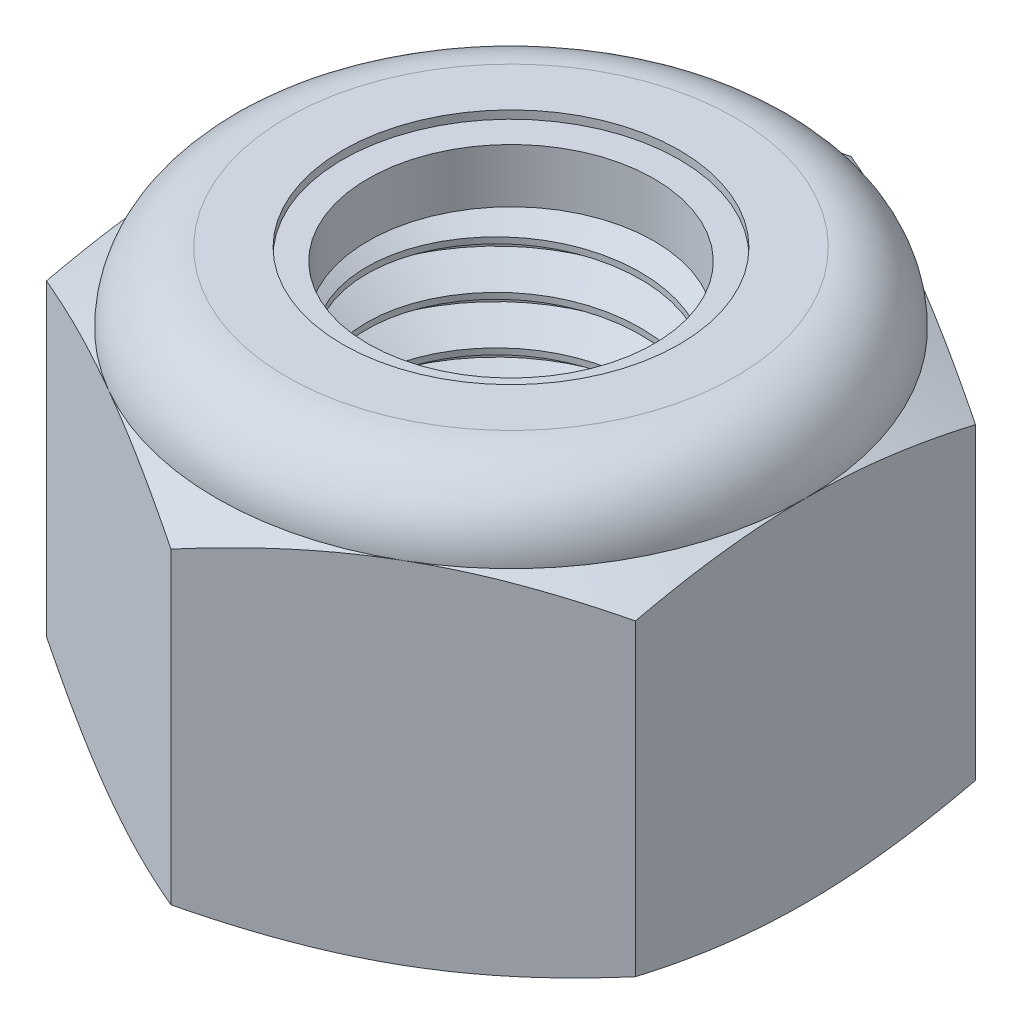
from build123d import *

# Parameters (mm, degrees)
SKETCH1_R        = 3.175
EXTRUDE1_DEPTH   = 7.9375
SKETCH2_W        = 3.175
SKETCH2_H        = 6.614583333
CUT_SWEEP1_PITCH = 0.907142857
SKETCH12_W       = 3.4925
SKETCH12_H       = 6.614583333


with BuildPart() as part:
    # Sketch1 → Extrude1 (new body)
    with BuildSketch(Plane(origin=(0, 0, 0), x_dir=(1, 0, 0), z_dir=(0, 1, 0))):
        Polygon((0, 6.415804866), (-5.55625, 3.207902433), (-5.55625, -3.207902433), (0, -6.415804866), (5.55625, -3.207902433), (5.55625, 3.207902433), align=None)
        with Locations(Location((0, 0, 0), (0, 0, 270))):
            Circle(SKETCH1_R, mode=Mode.SUBTRACT)
    extrude(amount=EXTRUDE1_DEPTH)

    # Sketch5 → Cut-Revolve3 (revolve, cut)
    with BuildSketch(Plane(origin=(0, 0, 0), x_dir=(0, 0, -1), z_dir=(1, 0, 0))):
        with BuildLine():
            Line((0, 0), (5.55625, 0))
            Line((5.55625, 0), (6.415804866, 0.400817017))
            Line((6.415804866, 0.400817017), (6.415804866, 6.213766317))
            Line((6.415804866, 6.213766317), (5.55625, 6.614583333))
            ThreePointArc((5.55625, 6.614583333), (5.168776679, 7.550026679), (4.233333333, 7.9375))
            Line((4.233333333, 7.9375), (4.233333333, 9.2075))
            Line((4.233333333, 9.2075), (7.685804866, 9.2075))
            Line((7.685804866, 9.2075), (7.685804866, -1.27))
            Line((7.685804866, -1.27), (0, -1.27))
            Line((0, -1.27), (0, 0))
        make_face()
    revolve(axis=Axis((0, 0, 0), (0, 1, 0)), mode=Mode.SUBTRACT)

    # Sketch6 → Cut-Revolve4 (revolve, cut)
    with BuildSketch(Plane(origin=(0, 0, 0), x_dir=(0, 0, -1), z_dir=(1, 0, 0)), mode=Mode.PRIVATE) as cut_revolve4_sk:
        with BuildLine():
            Line((0, 6.614583333), (5.40385, 6.614583333))
            ThreePointArc((5.40385, 6.614583333), (5.061013606, 7.442263606), (4.233333333, 7.7851))
            Line((4.233333333, 7.7851), (2.116666667, 7.7851))
            Line((2.116666667, 7.7851), (2.116666667, 9.2075))
            Line((2.116666667, 9.2075), (0, 9.2075))
            Line((0, 9.2075), (0, 6.614583333))
        make_face()
    revolve(cut_revolve4_sk.sketch.rotate(Axis((0, 9.2075, 0), (0, -1, 0)), 180), axis=Axis((0, 9.2075, 0), (0, -1, 0)), mode=Mode.SUBTRACT)

    # Sketch4 → Cut-Revolve2 (revolve, cut)
    with BuildSketch(Plane(origin=(0, 0, 0), x_dir=(0, 0, -1), z_dir=(1, 0, 0))):
        Polygon((0, 6.614583333), (3.4925, 6.614583333), (0, 4.986003837), align=None)
        Polygon((0, 1.628579496), (3.4925, 0), (0, 0), align=None)
    revolve(axis=Axis((0, 0, 0), (0, 1, 0)), mode=Mode.SUBTRACT)

    # Sketch12 → Revolve4 (revolve)
    with BuildSketch(Plane(origin=(0, 0, 0), x_dir=(0, 0, -1), z_dir=(1, 0, 0)), mode=Mode.PRIVATE) as revolve4_sk:
        with Locations((1.74625, 3.307291667)):
            Rectangle(SKETCH12_W, SKETCH12_H)
    revolve(revolve4_sk.sketch.rotate(Axis((0, 0, 0), (0, 1, 0)), 358.692608044), axis=Axis((0, 0, 0), (0, 1, 0)))


with BuildPart() as body_2:
    # Sketch7 → Revolve2 (revolve)
    with BuildSketch(Plane(origin=(0, 0, 0), x_dir=(0, 0, -1), z_dir=(1, 0, 0))):
        with BuildLine():
            Line((2.69875, 6.690783333), (5.324993778, 6.690783333))
            ThreePointArc((5.324993778, 6.690783333), (4.979705237, 7.4148695), (4.233333333, 7.7089))
            Line((4.233333333, 7.7089), (2.69875, 7.7089))
            Line((2.69875, 7.7089), (2.69875, 6.690783333))
        make_face()
    revolve(axis=Axis((0, 6.690783333, 0), (0, 1, 0)))


with BuildPart() as body_3:
    # Sketch2 → Revolve1 (revolve)
    with BuildSketch(Plane(origin=(0, 0, 0), x_dir=(0, 0, -1), z_dir=(1, 0, 0))):
        with Locations((1.5875, 3.307291667)):
            Rectangle(SKETCH2_W, SKETCH2_H)
    revolve(axis=Axis((0, -3.175, 0), (0, 1, 0)))

    # Cut-Sweep1: the profile of Sketch9 screwed along a right-hand helix of 9.75 turns, 8 arcs to a turn; built about Z, then put on its axis
    cut_sweep1_z = Axis((0, 0, 0), (0, 0, 1))
    cut_sweep1_corners = [(3.273201095, 0, 0.056696429), (3.224100547, 0, -0.822098214), (2.585793431, 0, -0.453571429), (2.585793431, 0, -0.340178571)]
    with BuildLine(mode=Mode.PRIVATE) as cut_sweep1_profile:
        Line(cut_sweep1_corners[0], cut_sweep1_corners[1])
        Line(cut_sweep1_corners[1], cut_sweep1_corners[2])
        Line(cut_sweep1_corners[2], cut_sweep1_corners[3])
        Line(cut_sweep1_corners[3], cut_sweep1_corners[0])
    cut_sweep1_cap = Face(cut_sweep1_profile.wire())
    cut_sweep1_turn_angles = [0, 22.5, 45, 67.5, 90, 112.5, 135, 157.5, 180, 202.5, 225, 247.5, 270, 292.5, 315, 337.5, 360]
    cut_sweep1_turn_weights = [1, 0.9238795325112867, 1, 0.9238795325112867, 1, 0.9238795325112867, 1, 0.9238795325112867, 1, 0.9238795325112867, 1, 0.9238795325112867, 1, 0.9238795325112867, 1, 0.9238795325112867, 1]
    cut_sweep1_turn_rails = [Edge.make_bspline([Vector(p[0], p[1], 0).rotate(cut_sweep1_z, cut_sweep1_turn_angles[k]) / cut_sweep1_turn_weights[k] + Vector(0, 0, p[2] + CUT_SWEEP1_PITCH * cut_sweep1_turn_angles[k] / 360) for k in range(17)], [0, 0, 0, 1, 1, 2, 2, 3, 3, 4, 4, 5, 5, 6, 6, 7, 7, 8, 8, 8], 2, cut_sweep1_turn_weights) for p in cut_sweep1_corners]
    cut_sweep1_turn_sides = [Face.make_surface_from_curves(cut_sweep1_turn_rails[p[0]], cut_sweep1_turn_rails[p[1]]) for p in [(0, 1), (1, 2), (2, 3), (3, 0)]]
    cut_sweep1_last_angles = [3240, 3262.5, 3285, 3307.5, 3330, 3352.5, 3375, 3397.5, 3420, 3442.5, 3465, 3487.5, 3510]
    cut_sweep1_last_weights = [1, 0.9238795325112867, 1, 0.9238795325112867, 1, 0.9238795325112867, 1, 0.9238795325112867, 1, 0.9238795325112867, 1, 0.9238795325112715, 1]
    cut_sweep1_last_rails = [Edge.make_bspline([Vector(p[0], p[1], 0).rotate(cut_sweep1_z, cut_sweep1_last_angles[k]) / cut_sweep1_last_weights[k] + Vector(0, 0, p[2] + CUT_SWEEP1_PITCH * cut_sweep1_last_angles[k] / 360) for k in range(13)], [0, 0, 0, 1, 1, 2, 2, 3, 3, 4, 4, 5, 5, 6, 6, 6], 2, cut_sweep1_last_weights) for p in cut_sweep1_corners]
    cut_sweep1_last_sides = [Face.make_surface_from_curves(cut_sweep1_last_rails[p[0]], cut_sweep1_last_rails[p[1]]) for p in [(0, 1), (1, 2), (2, 3), (3, 0)]]
    cut_sweep1 = Plane(origin=(0, 6.614583333, 0), x_dir=(0, 0, -1), z_dir=(0, -1, 0)) * Solid(Shell([*[p.moved(Location((0, 0, CUT_SWEEP1_PITCH * i))) for i in range(9) for p in cut_sweep1_turn_sides], *cut_sweep1_last_sides, cut_sweep1_cap, cut_sweep1_cap.rotate(cut_sweep1_z, 3510).moved(Location((0, 0, CUT_SWEEP1_PITCH * 3510 / 360)))]))
    add(cut_sweep1, mode=Mode.SUBTRACT)

    # Sketch11 → Revolve3 (revolve)
    with BuildSketch(Plane(origin=(0, 0, 0), x_dir=(0, 0, -1), z_dir=(1, 0, 0))):
        Polygon((0, 0), (3.4925, 0), (0, 1.628579496), align=None)
    revolve(axis=Axis((0, 7.9375, 0), (0, -1, 0)))


with BuildPart() as part_1:
    add(part.part)

    # Combine1: cut body 3
    add(body_3.part, mode=Mode.SUBTRACT)


solid = Compound([body_2.part, part_1.part])
